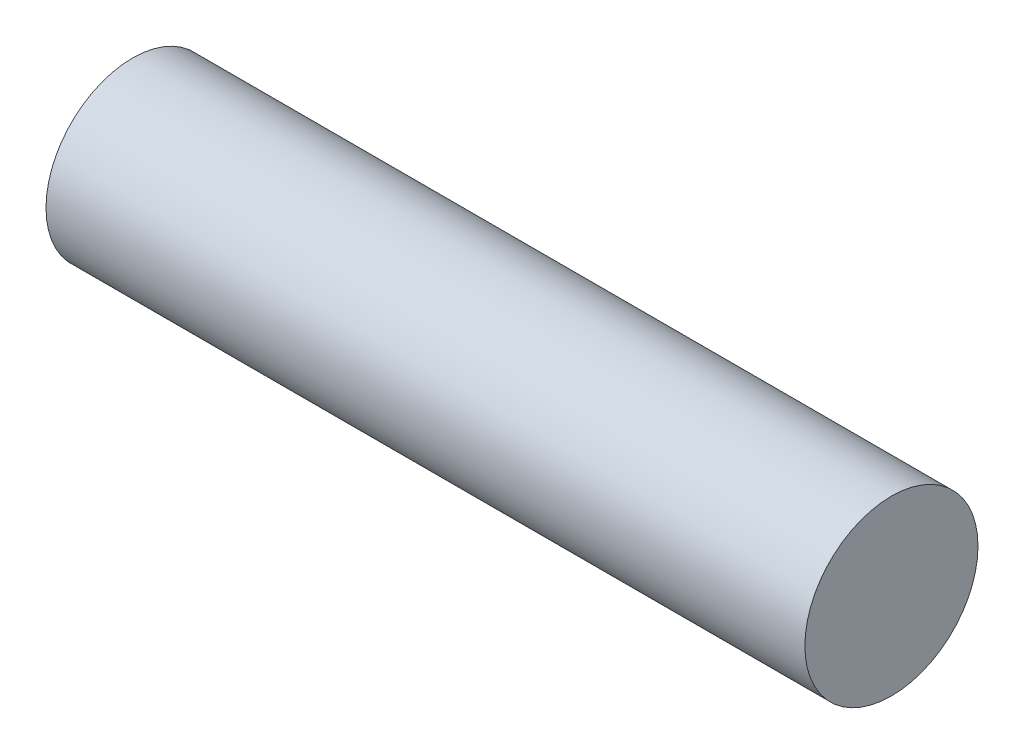
from build123d import *

# Parameters (mm, degrees)
SURFACE_EXTRUDE4_START     = -1.778
SURFACE_EXTRUDE4_OUTLINE_R = 1.709503837
SURFACE_EXTRUDE4_DEPTH     = 14.986


# Read off the part's stored shape, not the designer's step: Surface-Extrude4
with BuildPart() as part:
    # Surface-Extrude4 outline → Surface-Extrude4 (new body)
    with BuildSketch(Plane.ZY.offset(-0.2921).offset(SURFACE_EXTRUDE4_START)):
        with Locations((37.259820513, -0.026967113)):
            Circle(SURFACE_EXTRUDE4_OUTLINE_R)
    extrude(amount=SURFACE_EXTRUDE4_DEPTH)


solid = part.part
